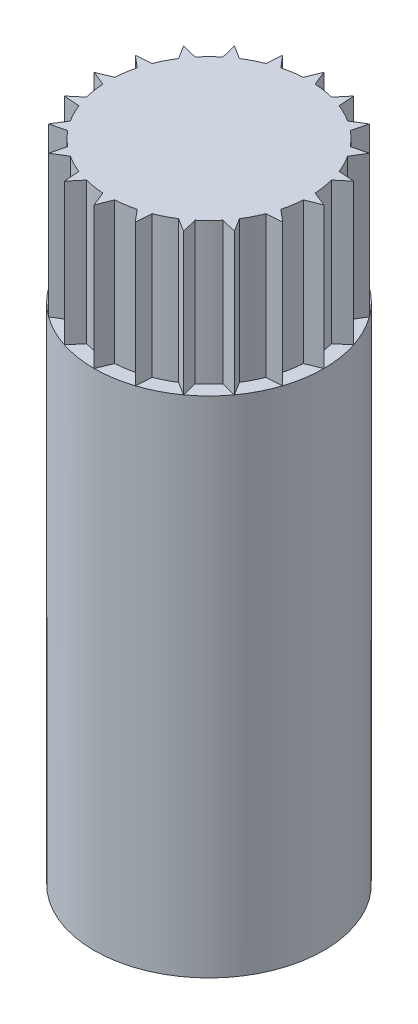
from build123d import *

# Parameters (mm, degrees)
SKETCH1_R           = 4.86
BOSS_EXTRUDE1_DEPTH = 21.336
BOSS_EXTRUDE2_DEPTH = 6


with BuildPart() as part:
    # Sketch1 → Boss-Extrude1 (new body)
    with BuildSketch(Plane(origin=(0, 0, 0), x_dir=(1, 0, 0), z_dir=(0, 1, 0))):
        Circle(SKETCH1_R)
    extrude(amount=BOSS_EXTRUDE1_DEPTH)

    # Sketch2 → Boss-Extrude2 (add)
    with BuildSketch(Plane(origin=(0, 21.336, 0), x_dir=(1, 0, 0), z_dir=(0, 1, 0))):
        with BuildLine():
            Line((0, 4.86), (0.250754017, 4.242596189))
            ThreePointArc((0.250754017, 4.242596189), (0.664846476, 4.197675448), (1.072553081, 4.112436004))
            Line((1.072553081, 4.112436004), (1.501822593, 4.622134669))
            Line((1.501822593, 4.622134669), (1.549515564, 3.957461499))
            ThreePointArc((1.549515564, 3.957461499), (1.929459624, 3.786777728), (2.29087121, 3.57972193))
            Line((2.29087121, 3.57972193), (2.856636326, 3.931822593))
            Line((2.856636326, 3.931822593), (2.696599732, 3.284942904))
            ThreePointArc((2.696599732, 3.284942904), (3.00520382, 3.00520382), (3.284942904, 2.696599732))
            Line((3.284942904, 2.696599732), (3.931822593, 2.856636326))
            Line((3.931822593, 2.856636326), (3.57972193, 2.29087121))
            ThreePointArc((3.57972193, 2.29087121), (3.786777728, 1.929459624), (3.957461499, 1.549515564))
            Line((3.957461499, 1.549515564), (4.622134669, 1.501822593))
            Line((4.622134669, 1.501822593), (4.112436004, 1.072553081))
            ThreePointArc((4.112436004, 1.072553081), (4.197675448, 0.664846476), (4.242596189, 0.250754017))
            Line((4.242596189, 0.250754017), (4.86, 0))
            Line((4.86, 0), (4.242596189, -0.250754017))
            ThreePointArc((4.242596189, -0.250754017), (4.197675448, -0.664846476), (4.112436004, -1.072553081))
            Line((4.112436004, -1.072553081), (4.622134669, -1.501822593))
            Line((4.622134669, -1.501822593), (3.957461499, -1.549515564))
            ThreePointArc((3.957461499, -1.549515564), (3.786777728, -1.929459624), (3.57972193, -2.29087121))
            Line((3.57972193, -2.29087121), (3.931822593, -2.856636326))
            Line((3.931822593, -2.856636326), (3.284942904, -2.696599732))
            ThreePointArc((3.284942904, -2.696599732), (3.00520382, -3.00520382), (2.696599732, -3.284942904))
            Line((2.696599732, -3.284942904), (2.856636326, -3.931822593))
            Line((2.856636326, -3.931822593), (2.29087121, -3.57972193))
            ThreePointArc((2.29087121, -3.57972193), (1.929459624, -3.786777728), (1.549515564, -3.957461499))
            Line((1.549515564, -3.957461499), (1.501822593, -4.622134669))
            Line((1.501822593, -4.622134669), (1.072553081, -4.112436004))
            ThreePointArc((1.072553081, -4.112436004), (0.664846476, -4.197675448), (0.250754017, -4.242596189))
            Line((0.250754017, -4.242596189), (0, -4.86))
            Line((0, -4.86), (-0.250754017, -4.242596189))
            ThreePointArc((-0.250754017, -4.242596189), (-0.664846476, -4.197675448), (-1.072553081, -4.112436004))
            Line((-1.072553081, -4.112436004), (-1.501822593, -4.622134669))
            Line((-1.501822593, -4.622134669), (-1.549515564, -3.957461499))
            ThreePointArc((-1.549515564, -3.957461499), (-1.929459624, -3.786777728), (-2.29087121, -3.57972193))
            Line((-2.29087121, -3.57972193), (-2.856636326, -3.931822593))
            Line((-2.856636326, -3.931822593), (-2.696599732, -3.284942904))
            ThreePointArc((-2.696599732, -3.284942904), (-3.00520382, -3.00520382), (-3.284942904, -2.696599732))
            Line((-3.284942904, -2.696599732), (-3.931822593, -2.856636326))
            Line((-3.931822593, -2.856636326), (-3.57972193, -2.29087121))
            ThreePointArc((-3.57972193, -2.29087121), (-3.786777728, -1.929459624), (-3.957461499, -1.549515564))
            Line((-3.957461499, -1.549515564), (-4.622134669, -1.501822593))
            Line((-4.622134669, -1.501822593), (-4.112436004, -1.072553081))
            ThreePointArc((-4.112436004, -1.072553081), (-4.197675448, -0.664846476), (-4.242596189, -0.250754017))
            Line((-4.242596189, -0.250754017), (-4.86, 0))
            Line((-4.86, 0), (-4.242596189, 0.250754017))
            ThreePointArc((-4.242596189, 0.250754017), (-4.197675448, 0.664846476), (-4.112436004, 1.072553081))
            Line((-4.112436004, 1.072553081), (-4.622134669, 1.501822593))
            Line((-4.622134669, 1.501822593), (-3.957461499, 1.549515564))
            ThreePointArc((-3.957461499, 1.549515564), (-3.786777728, 1.929459624), (-3.57972193, 2.29087121))
            Line((-3.57972193, 2.29087121), (-3.931822593, 2.856636326))
            Line((-3.931822593, 2.856636326), (-3.284942904, 2.696599732))
            ThreePointArc((-3.284942904, 2.696599732), (-3.00520382, 3.00520382), (-2.696599732, 3.284942904))
            Line((-2.696599732, 3.284942904), (-2.856636326, 3.931822593))
            Line((-2.856636326, 3.931822593), (-2.29087121, 3.57972193))
            ThreePointArc((-2.29087121, 3.57972193), (-1.929459624, 3.786777728), (-1.549515564, 3.957461499))
            Line((-1.549515564, 3.957461499), (-1.501822593, 4.622134669))
            Line((-1.501822593, 4.622134669), (-1.072553081, 4.112436004))
            ThreePointArc((-1.072553081, 4.112436004), (-0.664846476, 4.197675448), (-0.250754017, 4.242596189))
            Line((-0.250754017, 4.242596189), (0, 4.86))
        make_face()
    extrude(amount=BOSS_EXTRUDE2_DEPTH)


solid = part.part
